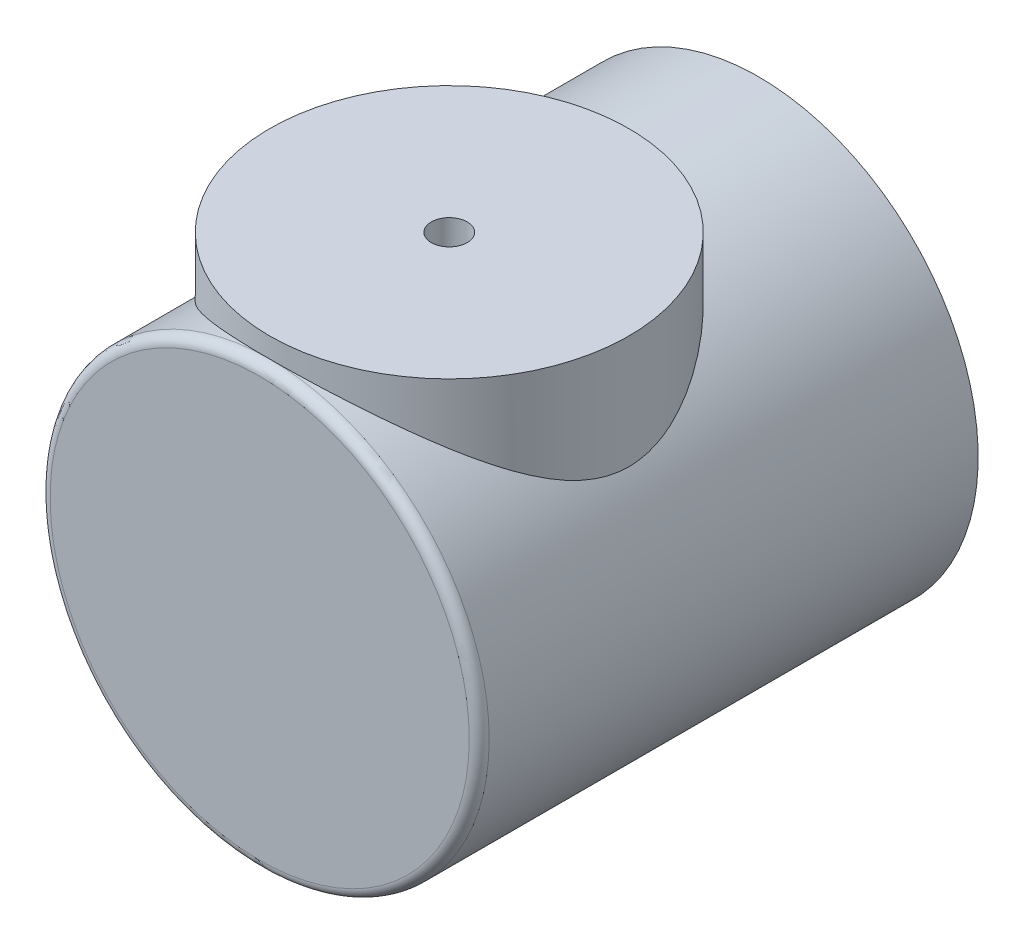
from build123d import *

# Parameters (mm, degrees)
ESBO_O1_R                   = 55
RESSALTO_EXTRUS_O1_DEPTH    = 115
ESBO_O2_R                   = 45
RESSALTO_EXTRUS_O2_DEPTH    = 60
ESBO_O3_R                   = 4.5
CORTE_EXTRUS_O1_DEPTH       = 6
FILETE1_R                   = 2.5
ESBO_O10_R                  = 4.5
CORTE_EXTRUS_O7_DEPTH       = 7.5
CORTE_EXTRUS_O8_REACH       = 168.752
CORTE_EXTRUS_O8_END_RADIUS  = 55
ESBO_O11_R                  = 8.5
CORTE_EXTRUS_O12_DEPTH      = 6.7
ESBO_O17_R                  = 4.5
CORTE_EXTRUS_O13_DEPTH      = 15
CORTE_EXTRUS_O14_DEPTH      = 15
CORTE_EXTRUS_O14_DEPTH_BACK = 15
ESBO_O18_R                  = 1.95
ESBO_O19_W                  = 50
ESBO_O19_H                  = 20
CORTE_EXTRUS_O15_DEPTH      = 53
CORTE_EXTRUS_O16_REACH      = 146.099
ESBO_O20_W                  = 13
ESBO_O20_H                  = 6.7
ESBO_O21_W                  = 10
ESBO_O21_H                  = 20
RESSALTO_EXTRUS_O4_DEPTH    = 30.9
CORTE_EXTRUS_O17_DEPTH      = 39.05
CORTE_EXTRUS_O17_DEPTH_BACK = 9.05
ESBO_O22_W                  = 5.8
ESBO_O22_H                  = 3.2
ESBO_O23_R                  = 1.6
CORTE_EXTRUS_O18_DEPTH      = 10
RESSALTO_EXTRUS_O5_START    = 10
ESBO_O24_R                  = 55
ESBO_O24_R_2                = 47.5
RESSALTO_EXTRUS_O5_DEPTH    = 10


with BuildPart() as part:
    # Esboço1 → Ressalto-extrusão1 (new body)
    with BuildSketch(Plane.XY):
        Circle(ESBO_O1_R)
    extrude(amount=RESSALTO_EXTRUS_O1_DEPTH)

    # Esboço2 → Ressalto-extrusão2 (add)
    with BuildSketch(Plane(origin=(0, 0, 0), x_dir=(1, 0, 0), z_dir=(0, 1, 0))):
        with Locations(Location((0, -67.5, 0), (0, 0, 90))):
            Circle(ESBO_O2_R)
    extrude(amount=RESSALTO_EXTRUS_O2_DEPTH)

    # Esboço3 → Corte-extrusão1 (cut)
    with BuildSketch(Plane(origin=(0, 0, 0), x_dir=(-1, 0, 0), z_dir=(0, 0, -1))):
        Circle(ESBO_O3_R)
    extrude(amount=-CORTE_EXTRUS_O1_DEPTH, mode=Mode.SUBTRACT)

    # Filete1
    filete1_edges = [part.edges().sort_by_distance(p)[0] for p in [
        (-55, 0, 115),
    ]]
    fillet(filete1_edges, radius=FILETE1_R - 0.0001)  # a hair under: the kernel refuses the full size

    # Esboço10 → Corte-extrusão7 (cut)
    with BuildSketch(Plane(origin=(0, 60, 0), x_dir=(1, 0, 0), z_dir=(0, 1, 0))):
        with Locations(Location((0, -67.5, 0), (0, 0, 270))):
            Circle(ESBO_O10_R)
    extrude(amount=-CORTE_EXTRUS_O7_DEPTH, mode=Mode.SUBTRACT)

    # Corte-extrusão8: up to this cylinder (the profile starts inside it)
    corte_extrus_o8_end = Plane(origin=(0, 0, 67.5), z_dir=(0, 0, -1)) * Cylinder(CORTE_EXTRUS_O8_END_RADIUS, 448.504, mode=Mode.PRIVATE)
    # Esboço11 → Corte-extrusão8 (cut, up to the surface)
    with BuildSketch(Plane(origin=(0, 52.5, 0), x_dir=(1, 0, 0), z_dir=(0, 1, 0)), mode=Mode.PRIVATE) as corte_extrus_o8_sk1:
        with Locations(Location((0, -67.5, 0), (0, 0, 270))):
            Circle(ESBO_O11_R)
    corte_extrus_o8_tool1 = extrude(corte_extrus_o8_sk1.sketch, amount=-CORTE_EXTRUS_O8_REACH, mode=Mode.PRIVATE) & corte_extrus_o8_end
    add(corte_extrus_o8_tool1.solids().sort_by_distance((0, 52.5, 67.5))[0], mode=Mode.SUBTRACT)

    # Esboço16 → Corte-extrusão12 (cut)
    with BuildSketch(Plane(origin=(0, 0, 6), x_dir=(-1, 0, 0), z_dir=(0, 0, -1))):
        with BuildLine():
            Line((-6.5, 3.073450829), (-6.5, -7.19))
            Line((-6.5, -7.19), (6.5, -7.19))
            Line((6.5, -7.19), (6.5, 3.073450829))
            ThreePointArc((6.5, 3.073450829), (0, 7.19), (-6.5, 3.073450829))
        make_face()
    extrude(amount=-CORTE_EXTRUS_O12_DEPTH, mode=Mode.SUBTRACT)

    # Esboço17 → Corte-extrusão13 (cut)
    with BuildSketch(Plane(origin=(0, 0, 12.7), x_dir=(-1, 0, 0), z_dir=(0, 0, -1))):
        Circle(ESBO_O17_R)
    extrude(amount=-CORTE_EXTRUS_O13_DEPTH, mode=Mode.SUBTRACT)

    # Esboço18 → Corte-extrusão14 (cut, two sides: drawn at the far end of the back side and taken through both)
    with BuildSketch(Plane(origin=(0, 0, 0), x_dir=(1, 0, 0), z_dir=(0, 1, 0)).offset(-CORTE_EXTRUS_O14_DEPTH_BACK)):
        with Locations(Location((0, -17.8, 0), (0, 0, 90))):
            Circle(ESBO_O18_R)
    extrude(amount=CORTE_EXTRUS_O14_DEPTH + CORTE_EXTRUS_O14_DEPTH_BACK, mode=Mode.SUBTRACT)

    # Esboço19 → Corte-extrusão15 (cut)
    with BuildSketch(Plane(origin=(0, -15, 0), x_dir=(1, 0, 0), z_dir=(0, 1, 0))):
        with Locations((0, -15)):
            Rectangle(ESBO_O19_W, ESBO_O19_H)
    extrude(amount=-CORTE_EXTRUS_O15_DEPTH, mode=Mode.SUBTRACT)

    # Esboço20 → Corte-extrusão16 (cut, up to next)
    with BuildSketch(Plane(origin=(0, -7.19, 0), x_dir=(1, 0, 0), z_dir=(0, 1, 0)), mode=Mode.PRIVATE) as corte_extrus_o16_sk1:
        with Locations((0, -9.35)):
            Rectangle(ESBO_O20_W, ESBO_O20_H)
    corte_extrus_o16_tool1 = extrude(corte_extrus_o16_sk1.sketch, amount=-CORTE_EXTRUS_O16_REACH, mode=Mode.PRIVATE) & part.part
    add(corte_extrus_o16_tool1.solids().sort_by_distance((0, -7.19, 9.35))[0], mode=Mode.SUBTRACT)

    # Esboço21 → Ressalto-extrusão4 (add)
    with BuildSketch(Plane.XZ.offset(15)):
        with Locations((20, 15)):
            Rectangle(ESBO_O21_W, ESBO_O21_H)
        with Locations((-20, 15)):
            Rectangle(ESBO_O21_W, ESBO_O21_H)
    extrude(amount=RESSALTO_EXTRUS_O4_DEPTH)

    # Esboço22 → Corte-extrusão17 (cut, two sides: drawn at the far end of the back side and taken through both)
    with BuildSketch(Plane.ZY.offset(-15).offset(-CORTE_EXTRUS_O17_DEPTH_BACK)):
        with Locations((15, -41.3)):
            Rectangle(ESBO_O22_W, ESBO_O22_H)
    extrude(amount=CORTE_EXTRUS_O17_DEPTH + CORTE_EXTRUS_O17_DEPTH_BACK, mode=Mode.SUBTRACT)

    # Esboço23 → Corte-extrusão18 (cut)
    with BuildSketch(Plane.XZ.offset(45.9)):
        with Locations(Location((21, 15, 0), (0, 0, 270))):
            Circle(ESBO_O23_R)
        with Locations(Location((-21, 15, 0), (0, 0, 270))):
            Circle(ESBO_O23_R)
    extrude(amount=-CORTE_EXTRUS_O18_DEPTH, mode=Mode.SUBTRACT)

    # Esboço24 → Ressalto-extrusão5 (add)
    with BuildSketch(Plane(origin=(0, 0, 0), x_dir=(-1, 0, 0), z_dir=(0, 0, -1)).offset(RESSALTO_EXTRUS_O5_START)):
        Circle(ESBO_O24_R)
        Circle(ESBO_O24_R_2, mode=Mode.SUBTRACT)
    extrude(amount=-RESSALTO_EXTRUS_O5_DEPTH)


solid = part.part
